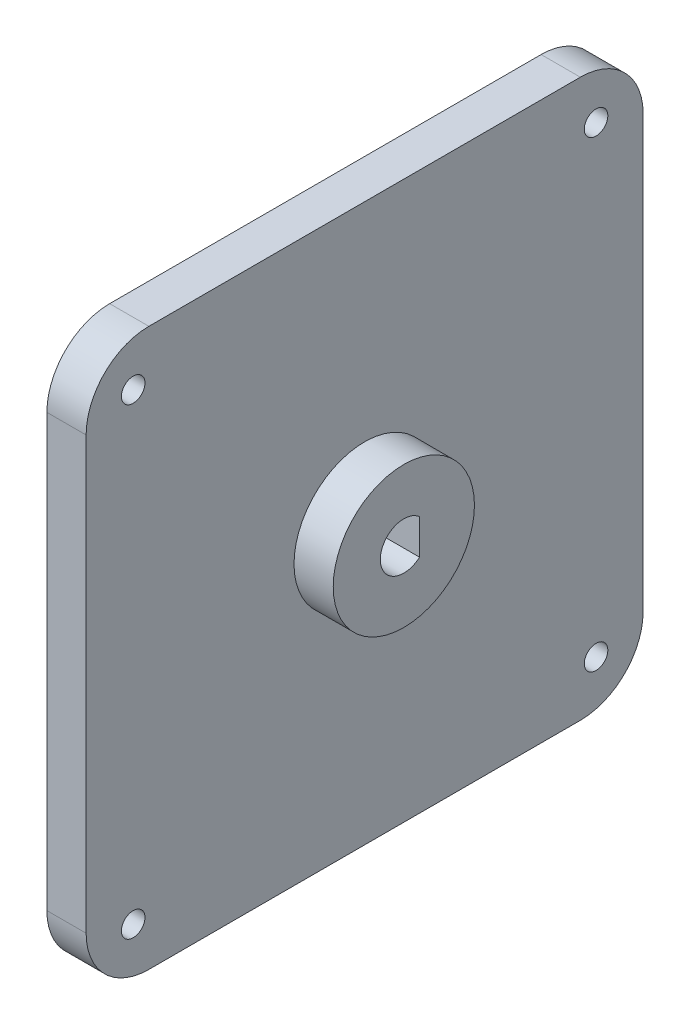
from build123d import *

# Parameters (mm, degrees)
SKETCH1_W           = 71
SKETCH1_H           = 71
SKETCH1_R           = 1.5
BOSS_EXTRUDE1_DEPTH = 5
FILLET1_R           = 8
SKETCH2_R           = 9
BOSS_EXTRUDE2_DEPTH = 5
CUT_EXTRUDE1_DEPTH  = 101.905896755


with BuildPart() as part:
    # Sketch1 → Boss-Extrude1 (new body)
    with BuildSketch(Plane(origin=(0, 0, 0), x_dir=(0, 0, -1), z_dir=(1, 0, 0))):
        with Locations((35.5, 35.5)):
            Rectangle(SKETCH1_W, SKETCH1_H)
        with Locations((6, 6)):
            Circle(SKETCH1_R, mode=Mode.SUBTRACT)
        with Locations((6, 65)):
            Circle(SKETCH1_R, mode=Mode.SUBTRACT)
        with Locations((65, 65)):
            Circle(SKETCH1_R, mode=Mode.SUBTRACT)
        with Locations((65, 6)):
            Circle(SKETCH1_R, mode=Mode.SUBTRACT)
    extrude(amount=BOSS_EXTRUDE1_DEPTH)

    # Fillet1
    fillet1_edges = [part.edges().sort_by_distance(p)[0] for p in [
        (2.5, 0, 0),
        (2.5, 0, -71),
        (2.5, 71, -71),
        (2.5, 71, 0),
    ]]
    fillet(fillet1_edges, radius=FILLET1_R)

    # Sketch2 → Boss-Extrude2 (add)
    with BuildSketch(Plane(origin=(5, 0, 0), x_dir=(0, 0, -1), z_dir=(1, 0, 0))):
        with Locations((35.5, 35.5)):
            Circle(SKETCH2_R)
    extrude(amount=BOSS_EXTRUDE2_DEPTH)

    # Sketch3 → Cut-Extrude1 (cut, through all)
    with BuildSketch(Plane(origin=(10, 0, 0), x_dir=(0, 0, -1), z_dir=(1, 0, 0))):
        with BuildLine():
            Line((37.5, 33.263932023), (37.5, 37.736067977))
            ThreePointArc((37.5, 37.736067977), (32.5, 35.5), (37.5, 33.263932023))
        make_face()
    extrude(amount=-CUT_EXTRUDE1_DEPTH, mode=Mode.SUBTRACT)


solid = part.part
